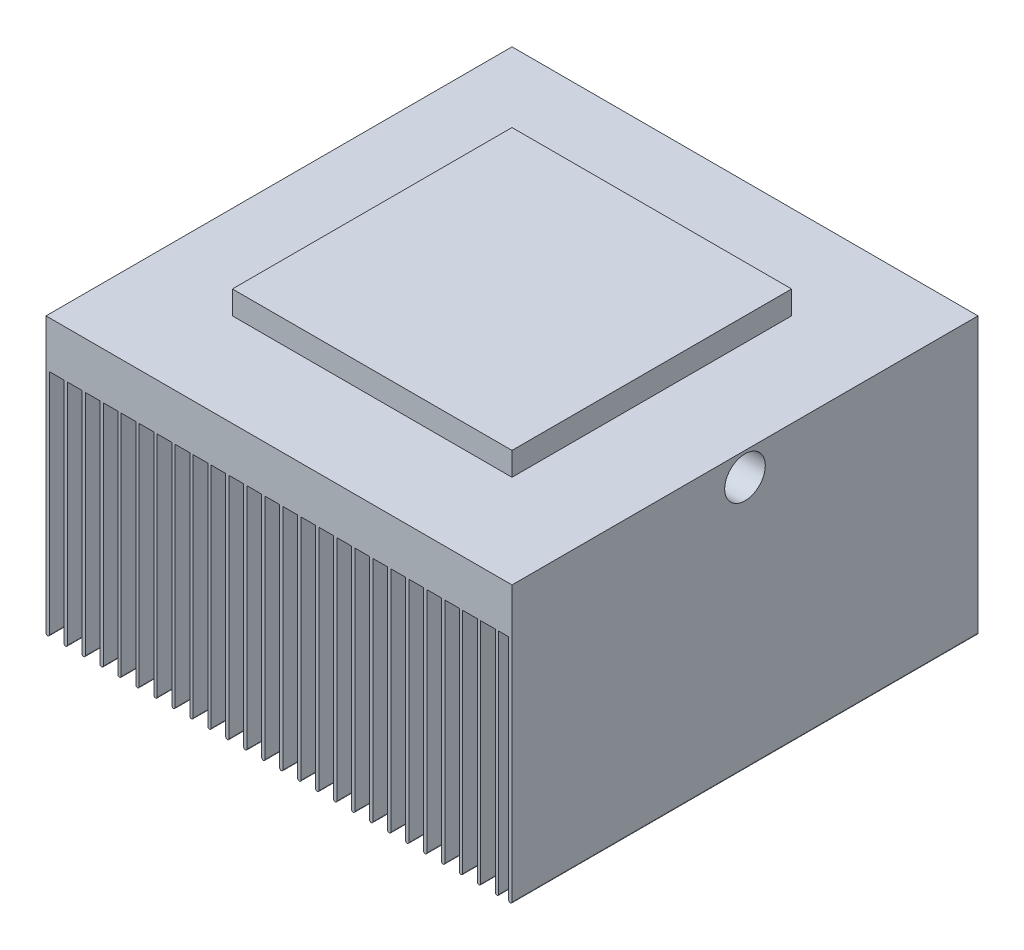
from build123d import *

# Parameters (mm, degrees)
SKETCH_1_W          = 70
SKETCH_1_H          = 70
EXTRUDE_1_DEPTH     = 41.5
SKETCH_2_W          = 42
SKETCH_2_H          = 42
EXTRUDE_2_DEPTH     = 3.5
CUT_EXTRUDE_1_DEPTH = 91.277350426
FILLET_1_R          = 0.25
FILLET_2_R          = 0.25
SKETCH_6_R          = 3.05
CUT_EXTRUDE_2_DEPTH = 52


with BuildPart() as part:
    # 草图1 → 凸台-拉伸1 (new body)
    with BuildSketch(Plane(origin=(0, 0, 0), x_dir=(1, 0, 0), z_dir=(0, 1, 0))):
        Rectangle(SKETCH_1_W, SKETCH_1_H)
    extrude(amount=EXTRUDE_1_DEPTH)

    # 草图2 → 凸台-拉伸2 (add)
    with BuildSketch(Plane(origin=(0, 41.5, 0), x_dir=(1, 0, 0), z_dir=(0, 1, 0))):
        Rectangle(SKETCH_2_W, SKETCH_2_H)
    extrude(amount=EXTRUDE_2_DEPTH)

    # 草图3 → 切除-拉伸1 (cut, through all)
    with BuildSketch(Plane.XY.offset(35)):
        with BuildLine():
            Line((-32.3, 34.5), (-34.5, 34.5))
            Line((-34.5, 34.5), (-34.5, 0.25))
            ThreePointArc((-34.5, 0.25), (-34.573223305, 0.073223305), (-34.75, 0))
            Line((-34.75, 0), (-32.05, 0))
            ThreePointArc((-32.05, 0), (-32.226776695, 0.073223305), (-32.3, 0.25))
            Line((-32.3, 0.25), (-32.3, 34.5))
        make_face()
        with BuildLine():
            Line((-29.6, 34.5), (-31.8, 34.5))
            Line((-31.8, 34.5), (-31.8, 0.25))
            ThreePointArc((-31.8, 0.25), (-31.873223305, 0.073223305), (-32.05, 0))
            Line((-32.05, 0), (-29.35, 0))
            ThreePointArc((-29.35, 0), (-29.526776695, 0.073223305), (-29.6, 0.25))
            Line((-29.6, 0.25), (-29.6, 34.5))
        make_face()
        with BuildLine():
            ThreePointArc((-29.1, 0.25), (-29.173223305, 0.073223305), (-29.35, 0))
            Line((-29.35, 0), (-26.65, 0))
            ThreePointArc((-26.65, 0), (-26.826776695, 0.073223305), (-26.9, 0.25))
            Line((-26.9, 0.25), (-26.9, 34.5))
            Line((-26.9, 34.5), (-29.1, 34.5))
            Line((-29.1, 34.5), (-29.1, 0.25))
        make_face()
        with BuildLine():
            ThreePointArc((-26.4, 0.25), (-26.473223305, 0.073223305), (-26.65, 0))
            Line((-26.65, 0), (-23.95, 0))
            ThreePointArc((-23.95, 0), (-24.126776695, 0.073223305), (-24.2, 0.25))
            Line((-24.2, 0.25), (-24.2, 34.5))
            Line((-24.2, 34.5), (-26.4, 34.5))
            Line((-26.4, 34.5), (-26.4, 0.25))
        make_face()
        with BuildLine():
            ThreePointArc((-23.7, 0.25), (-23.773223305, 0.073223305), (-23.95, 0))
            Line((-23.95, 0), (-21.25, 0))
            ThreePointArc((-21.25, 0), (-21.426776695, 0.073223305), (-21.5, 0.25))
            Line((-21.5, 0.25), (-21.5, 34.5))
            Line((-21.5, 34.5), (-23.7, 34.5))
            Line((-23.7, 34.5), (-23.7, 0.25))
        make_face()
        with BuildLine():
            ThreePointArc((-21, 0.25), (-21.073223305, 0.073223305), (-21.25, 0))
            Line((-21.25, 0), (-18.55, 0))
            ThreePointArc((-18.55, 0), (-18.726776695, 0.073223305), (-18.8, 0.25))
            Line((-18.8, 0.25), (-18.8, 34.5))
            Line((-18.8, 34.5), (-21, 34.5))
            Line((-21, 34.5), (-21, 0.25))
        make_face()
        with BuildLine():
            ThreePointArc((-18.3, 0.25), (-18.373223305, 0.073223305), (-18.55, 0))
            Line((-18.55, 0), (-15.85, 0))
            ThreePointArc((-15.85, 0), (-16.026776695, 0.073223305), (-16.1, 0.25))
            Line((-16.1, 0.25), (-16.1, 34.5))
            Line((-16.1, 34.5), (-18.3, 34.5))
            Line((-18.3, 34.5), (-18.3, 0.25))
        make_face()
        with BuildLine():
            ThreePointArc((-15.6, 0.25), (-15.673223305, 0.073223305), (-15.85, 0))
            Line((-15.85, 0), (-13.15, 0))
            ThreePointArc((-13.15, 0), (-13.326776695, 0.073223305), (-13.4, 0.25))
            Line((-13.4, 0.25), (-13.4, 34.5))
            Line((-13.4, 34.5), (-15.6, 34.5))
            Line((-15.6, 34.5), (-15.6, 0.25))
        make_face()
        with BuildLine():
            ThreePointArc((-12.9, 0.25), (-12.973223305, 0.073223305), (-13.15, 0))
            Line((-13.15, 0), (-10.45, 0))
            ThreePointArc((-10.45, 0), (-10.626776695, 0.073223305), (-10.7, 0.25))
            Line((-10.7, 0.25), (-10.7, 34.5))
            Line((-10.7, 34.5), (-12.9, 34.5))
            Line((-12.9, 34.5), (-12.9, 0.25))
        make_face()
        with BuildLine():
            ThreePointArc((-10.2, 0.25), (-10.273223305, 0.073223305), (-10.45, 0))
            Line((-10.45, 0), (-7.75, 0))
            ThreePointArc((-7.75, 0), (-7.926776695, 0.073223305), (-8, 0.25))
            Line((-8, 0.25), (-8, 34.5))
            Line((-8, 34.5), (-10.2, 34.5))
            Line((-10.2, 34.5), (-10.2, 0.25))
        make_face()
        with BuildLine():
            ThreePointArc((-7.5, 0.25), (-7.573223305, 0.073223305), (-7.75, 0))
            Line((-7.75, 0), (-5.05, 0))
            ThreePointArc((-5.05, 0), (-5.226776695, 0.073223305), (-5.3, 0.25))
            Line((-5.3, 0.25), (-5.3, 34.5))
            Line((-5.3, 34.5), (-7.5, 34.5))
            Line((-7.5, 34.5), (-7.5, 0.25))
        make_face()
        with BuildLine():
            ThreePointArc((-4.8, 0.25), (-4.873223305, 0.073223305), (-5.05, 0))
            Line((-5.05, 0), (-2.349999993, 0))
            ThreePointArc((-2.349999993, 0), (-2.526776693, 0.073223302), (-2.6, 0.25))
            Line((-2.6, 0.25), (-2.6, 34.5))
            Line((-2.6, 34.5), (-4.8, 34.5))
            Line((-4.8, 34.5), (-4.8, 0.25))
        make_face()
        with BuildLine():
            ThreePointArc((-2.1, 0.25), (-2.173223302, 0.073223307), (-2.349999993, 0))
            Line((-2.349999993, 0), (0.350000005, 0))
            ThreePointArc((0.350000005, 0), (0.173223306, 0.073223303), (0.1, 0.25))
            Line((0.1, 0.25), (0.1, 34.5))
            Line((0.1, 34.5), (-2.1, 34.5))
            Line((-2.1, 34.5), (-2.1, 0.25))
        make_face()
        with BuildLine():
            ThreePointArc((0.6, 0.25), (0.526776697, 0.073223306), (0.350000005, 0))
            Line((0.350000005, 0), (3.05, 0))
            ThreePointArc((3.05, 0), (2.873223305, 0.073223305), (2.8, 0.25))
            Line((2.8, 0.25), (2.8, 34.5))
            Line((2.8, 34.5), (0.6, 34.5))
            Line((0.6, 34.5), (0.6, 0.25))
        make_face()
        with BuildLine():
            ThreePointArc((3.3, 0.25), (3.226776695, 0.073223305), (3.05, 0))
            Line((3.05, 0), (5.749999995, 0))
            ThreePointArc((5.749999995, 0), (5.573223303, 0.073223307), (5.5, 0.25))
            Line((5.5, 0.25), (5.5, 34.5))
            Line((5.5, 34.5), (3.3, 34.5))
            Line((3.3, 34.5), (3.3, 0.25))
        make_face()
        with BuildLine():
            ThreePointArc((6, 0.25), (5.926776693, 0.073223303), (5.749999995, 0))
            Line((5.749999995, 0), (8.45, 0))
            ThreePointArc((8.45, 0), (8.273223305, 0.073223305), (8.2, 0.25))
            Line((8.2, 0.25), (8.2, 34.5))
            Line((8.2, 34.5), (6, 34.5))
            Line((6, 34.5), (6, 0.25))
        make_face()
        with BuildLine():
            ThreePointArc((8.7, 0.25), (8.626776695, 0.073223305), (8.45, 0))
            Line((8.45, 0), (11.149999998, 0))
            ThreePointArc((11.149999998, 0), (10.973223304, 0.073223305), (10.9, 0.25))
            Line((10.9, 0.25), (10.9, 34.5))
            Line((10.9, 34.5), (8.7, 34.5))
            Line((8.7, 34.5), (8.7, 0.25))
        make_face()
        with BuildLine():
            ThreePointArc((11.4, 0.25), (11.326776695, 0.073223304), (11.149999998, 0))
            Line((11.149999998, 0), (13.85, 0))
            ThreePointArc((13.85, 0), (13.673223305, 0.073223305), (13.6, 0.25))
            Line((13.6, 0.25), (13.6, 34.5))
            Line((13.6, 34.5), (11.4, 34.5))
            Line((11.4, 34.5), (11.4, 0.25))
        make_face()
        with BuildLine():
            ThreePointArc((14.1, 0.25), (14.026776695, 0.073223305), (13.85, 0))
            Line((13.85, 0), (16.55, 0))
            ThreePointArc((16.55, 0), (16.373223305, 0.073223305), (16.3, 0.25))
            Line((16.3, 0.25), (16.3, 34.5))
            Line((16.3, 34.5), (14.1, 34.5))
            Line((14.1, 34.5), (14.1, 0.25))
        make_face()
        with BuildLine():
            ThreePointArc((16.8, 0.25), (16.726776695, 0.073223305), (16.55, 0))
            Line((16.55, 0), (19.25, 0))
            ThreePointArc((19.25, 0), (19.073223305, 0.073223305), (19, 0.25))
            Line((19, 0.25), (19, 34.5))
            Line((19, 34.5), (16.8, 34.5))
            Line((16.8, 34.5), (16.8, 0.25))
        make_face()
        with BuildLine():
            ThreePointArc((19.5, 0.25), (19.426776695, 0.073223305), (19.25, 0))
            Line((19.25, 0), (21.95, 0))
            ThreePointArc((21.95, 0), (21.773223305, 0.073223305), (21.7, 0.25))
            Line((21.7, 0.25), (21.7, 34.5))
            Line((21.7, 34.5), (19.5, 34.5))
            Line((19.5, 34.5), (19.5, 0.25))
        make_face()
        with BuildLine():
            ThreePointArc((22.2, 0.25), (22.126776695, 0.073223305), (21.95, 0))
            Line((21.95, 0), (24.65, 0))
            ThreePointArc((24.65, 0), (24.473223305, 0.073223305), (24.4, 0.25))
            Line((24.4, 0.25), (24.4, 34.5))
            Line((24.4, 34.5), (22.2, 34.5))
            Line((22.2, 34.5), (22.2, 0.25))
        make_face()
        with BuildLine():
            ThreePointArc((24.9, 0.25), (24.826776695, 0.073223305), (24.65, 0))
            Line((24.65, 0), (27.35, 0))
            ThreePointArc((27.35, 0), (27.173223305, 0.073223305), (27.1, 0.25))
            Line((27.1, 0.25), (27.1, 34.5))
            Line((27.1, 34.5), (24.9, 34.5))
            Line((24.9, 34.5), (24.9, 0.25))
        make_face()
        with BuildLine():
            ThreePointArc((27.6, 0.25), (27.526776695, 0.073223305), (27.35, 0))
            Line((27.35, 0), (30.049999996, 0))
            ThreePointArc((30.049999996, 0), (29.873223303, 0.073223306), (29.8, 0.25))
            Line((29.8, 0.25), (29.8, 34.5))
            Line((29.8, 34.5), (27.6, 34.5))
            Line((27.6, 34.5), (27.6, 0.25))
        make_face()
        with BuildLine():
            ThreePointArc((30.3, 0.25), (30.226776694, 0.073223303), (30.049999996, 0))
            Line((30.049999996, 0), (32.75, 0))
            ThreePointArc((32.75, 0), (32.573223305, 0.073223305), (32.5, 0.25))
            Line((32.5, 0.25), (32.5, 34.5))
            Line((32.5, 34.5), (30.3, 34.5))
            Line((30.3, 34.5), (30.3, 0.25))
        make_face()
        with BuildLine():
            ThreePointArc((33, 0.25), (32.926776695, 0.073223305), (32.75, 0))
            Line((32.75, 0), (34.749999997, 0))
            ThreePointArc((34.749999997, 0), (34.573223304, 0.073223306), (34.5, 0.25))
            Line((34.5, 0.25), (34.5, 34.5))
            Line((34.5, 34.5), (33, 34.5))
            Line((33, 34.5), (33, 0.25))
        make_face()
    extrude(amount=-CUT_EXTRUDE_1_DEPTH, mode=Mode.SUBTRACT)

    # 圆角1
    fillet_1_edges = [part.edges().sort_by_distance(p)[0] for p in [
        (-35, 0, 0),
    ]]
    fillet(fillet_1_edges, radius=FILLET_1_R - 0.0001)  # a hair under: the kernel refuses the full size

    # 圆角2
    fillet_2_edges = [part.edges().sort_by_distance(p)[0] for p in [
        (35, 0, 0),
    ]]
    fillet(fillet_2_edges, radius=FILLET_2_R)

    # 草图6 → 切除-拉伸2 (cut)
    with BuildSketch(Plane(origin=(35, 0, 0), x_dir=(0, 0, -1), z_dir=(1, 0, 0))):
        with Locations((0, 38)):
            Circle(SKETCH_6_R)
    extrude(amount=-CUT_EXTRUDE_2_DEPTH, mode=Mode.SUBTRACT)


solid = part.part
